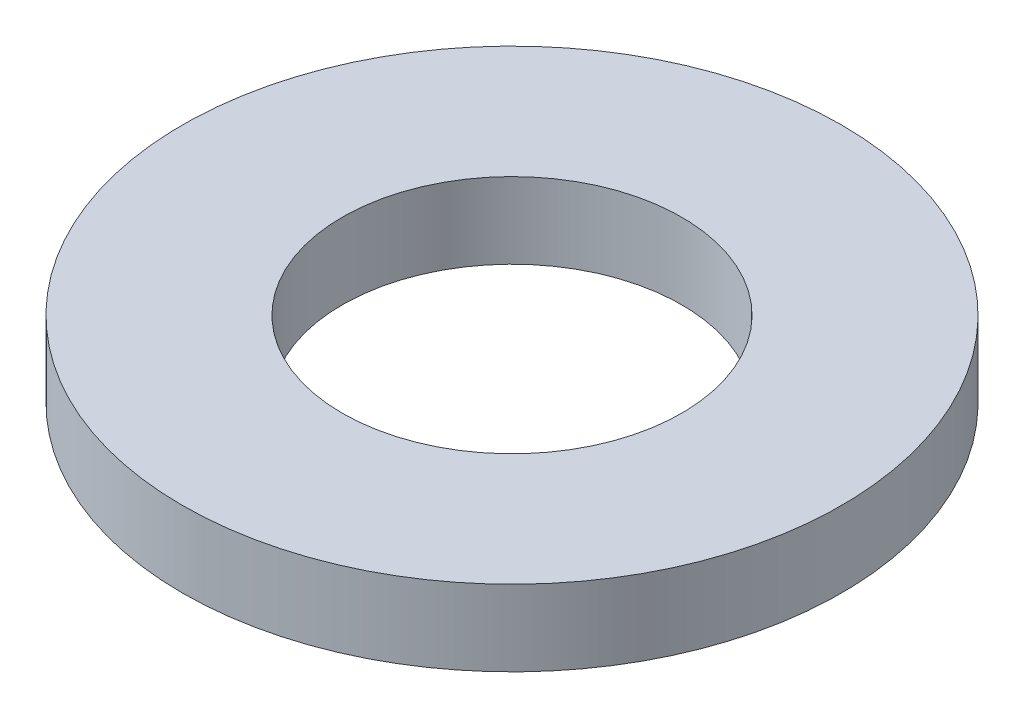
from build123d import *

# Parameters (mm, degrees)
SKETCH1_R           = 82.5
BOSS_EXTRUDE1_DEPTH = 19
SKETCH2_R           = 42.5
CUT_EXTRUDE1_DEPTH  = 119.209559681


with BuildPart() as part:
    # Sketch1 → Boss-Extrude1 (new body)
    with BuildSketch(Plane(origin=(0, 0, 0), x_dir=(1, 0, 0), z_dir=(0, 1, 0))):
        Circle(SKETCH1_R)
    extrude(amount=BOSS_EXTRUDE1_DEPTH)

    # Sketch2 → Cut-Extrude1 (cut, through all)
    with BuildSketch(Plane(origin=(0, 0, 0), x_dir=(1, 0, 0), z_dir=(0, 1, 0))):
        Circle(SKETCH2_R)
    extrude(amount=CUT_EXTRUDE1_DEPTH, mode=Mode.SUBTRACT)


solid = part.part
